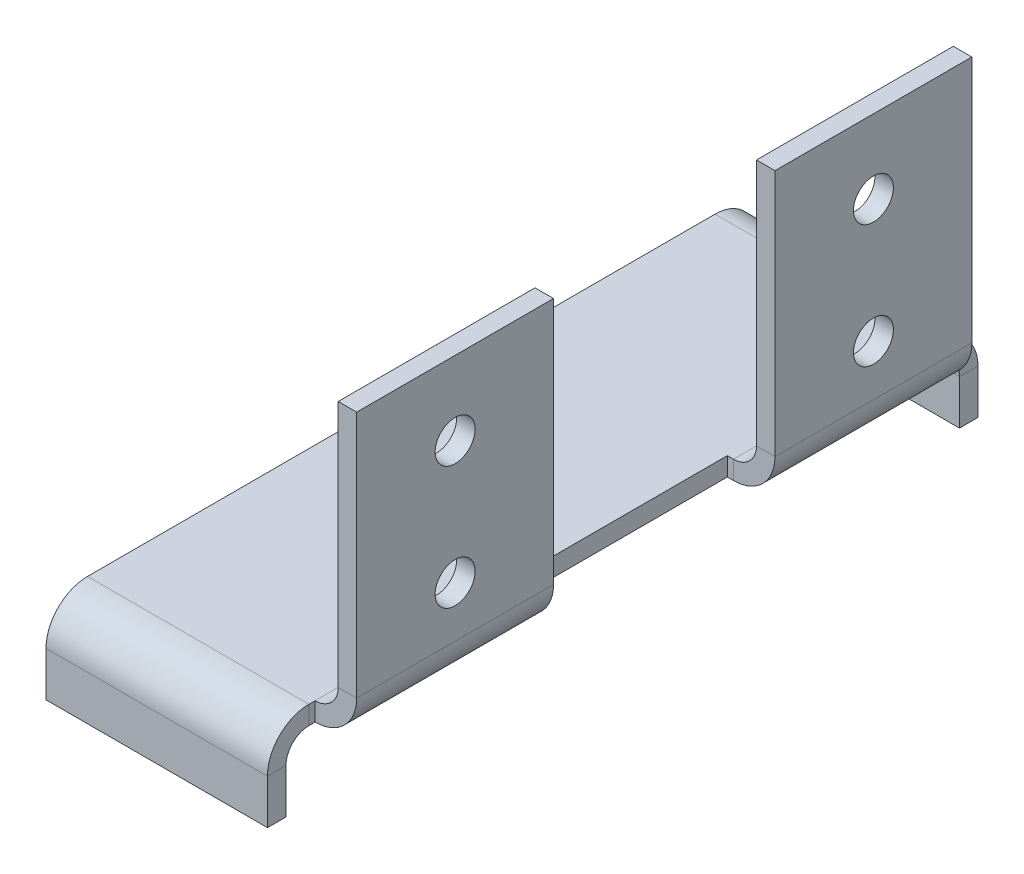
from build123d import *

# Parameters (mm, degrees)
BASE_FLANGE1_DEPTH      = 4.7752
EDGE_FLANGE1_DEPTH      = 50.8
EDGE_FLANGE1_BEND_DEPTH = 50.8
EDGE_FLANGE2_DEPTH      = 57.15
EDGE_FLANGE2_BEND_DEPTH = 57.15
CUT_EXTRUDE1_DEPTH      = 132.397433882
CUT_EXTRUDE1_DEPTH_BACK = 132.397433882
SKETCH18_R              = 5.159375
CUT_EXTRUDE3_DEPTH      = 122.772271015
CUT_EXTRUDE3_DEPTH_BACK = 122.772271015
SKETCH20_R              = 5.159375


# Sheet-metal steps are written as plain solids
with BuildPart() as part:
    # Sketch1 → Base-Flange1 (new body)
    with BuildSketch(Plane(origin=(0, 0, 0), x_dir=(1, 0, 0), z_dir=(0, 1, 0))):
        Polygon((26.9875, -28.575), (26.9875, 28.575), (28.575, 28.575), (28.575, 79.375), (-28.575, 79.375), (-28.575, -79.375), (28.575, -79.375), (28.575, -28.575), align=None)
    extrude(amount=-BASE_FLANGE1_DEPTH)

    # Edge-Flange1 section (across the edge) → Edge-Flange1 (add)
    with BuildSketch(Plane(origin=(34.5186, 0, -28.575), x_dir=(-1, 0, 0), z_dir=(0, 0, -1))):
        with BuildLine():
            Line((-4.7752, 5.9436), (-4.7752, 69.85))
            Line((-4.7752, 69.85), (0, 69.85))
            Line((0, 69.85), (0, 5.9436))
            ThreePointArc((0, 5.9436), (1.740840135, 1.740840135), (5.9436, 0))
            Line((5.9436, 0), (5.9436, -4.7752))
            ThreePointArc((5.9436, -4.7752), (-1.635736166, -1.635736166), (-4.7752, 5.9436))
        make_face()
    extrude(amount=EDGE_FLANGE1_DEPTH)

    # Edge-Flange1 section 2 (across the edge) → Edge-Flange1 bend (add)
    with BuildSketch(Plane(origin=(34.5186, 0, 79.375), x_dir=(-1, 0, 0), z_dir=(0, 0, -1))):
        with BuildLine():
            Line((-4.7752, 5.9436), (-4.7752, 69.85))
            Line((-4.7752, 69.85), (0, 69.85))
            Line((0, 69.85), (0, 5.9436))
            ThreePointArc((0, 5.9436), (1.740840135, 1.740840135), (5.9436, 0))
            Line((5.9436, 0), (5.9436, -4.7752))
            ThreePointArc((5.9436, -4.7752), (-1.635736166, -1.635736166), (-4.7752, 5.9436))
        make_face()
    extrude(amount=EDGE_FLANGE1_BEND_DEPTH)

    # Edge-Flange2 section (across the edge) → Edge-Flange2 (add)
    with BuildSketch(Plane(origin=(28.575, -4.7752, 86.9061), x_dir=(0, 0, -1), z_dir=(-1, 0, 0))):
        with BuildLine():
            Line((-4.7752, 5.9436), (-4.7752, 17.4498))
            Line((-4.7752, 17.4498), (0, 17.4498))
            Line((0, 17.4498), (0, 5.9436))
            ThreePointArc((0, 5.9436), (1.740840135, 1.740840135), (5.9436, 0))
            Line((5.9436, 0), (7.5311, 0))
            Line((7.5311, 0), (7.5311, -4.7752))
            Line((7.5311, -4.7752), (5.9436, -4.7752))
            ThreePointArc((5.9436, -4.7752), (-1.635736166, -1.635736166), (-4.7752, 5.9436))
        make_face()
    extrude(amount=EDGE_FLANGE2_DEPTH)

    # Edge-Flange2 section 2 (across the edge) → Edge-Flange2 bend (add)
    with BuildSketch(Plane(origin=(-28.575, -4.7752, -86.9061), x_dir=(0, 0, 1), z_dir=(1, 0, 0))):
        with BuildLine():
            Line((-4.7752, 5.9436), (-4.7752, 17.4498))
            Line((-4.7752, 17.4498), (0, 17.4498))
            Line((0, 17.4498), (0, 5.9436))
            ThreePointArc((0, 5.9436), (1.740840135, 1.740840135), (5.9436, 0))
            Line((5.9436, 0), (7.5311, 0))
            Line((7.5311, 0), (7.5311, -4.7752))
            Line((7.5311, -4.7752), (5.9436, -4.7752))
            ThreePointArc((5.9436, -4.7752), (-1.635736166, -1.635736166), (-4.7752, 5.9436))
        make_face()
    extrude(amount=EDGE_FLANGE2_BEND_DEPTH)

    # Sketch18 → Cut-Extrude1 (cut, two sides: drawn at the far end of the back side and taken through both)
    with BuildSketch(Plane.ZY.offset(-34.5186).offset(-CUT_EXTRUDE1_DEPTH_BACK)):
        with Locations(Location((-53.975, 50.8, 0), (0, 0, 270))):
            Circle(SKETCH18_R)
        with Locations(Location((-53.975, 19.05, 0), (0, 0, 270))):
            Circle(SKETCH18_R)
        with Locations(Location((53.975, 50.8, 0), (0, 0, 270))):
            Circle(SKETCH18_R)
        with Locations(Location((53.975, 19.05, 0), (0, 0, 270))):
            Circle(SKETCH18_R)
    extrude(amount=CUT_EXTRUDE1_DEPTH + CUT_EXTRUDE1_DEPTH_BACK, mode=Mode.SUBTRACT)

    # Sketch20 → Cut-Extrude3 (cut, two sides: drawn at the far end of the back side and taken through both)
    with BuildSketch(Plane(origin=(0, 0, 0), x_dir=(1, 0, 0), z_dir=(0, 1, 0)).offset(-CUT_EXTRUDE3_DEPTH_BACK)):
        with Locations((-72.900583951, 79.249926239)):
            Circle(SKETCH20_R)
        with Locations(Location((-3.175, 75.082739816, 0), (0, 0, 270))):
            Circle(SKETCH20_R)
        with Locations(Location((-9.236362071, -26.336291386, 0), (0, 0, 270))):
            Circle(SKETCH20_R)
        with Locations((-78.961946022, -22.169104962)):
            Circle(SKETCH20_R)
    extrude(amount=CUT_EXTRUDE3_DEPTH + CUT_EXTRUDE3_DEPTH_BACK, mode=Mode.SUBTRACT)


solid = part.part
